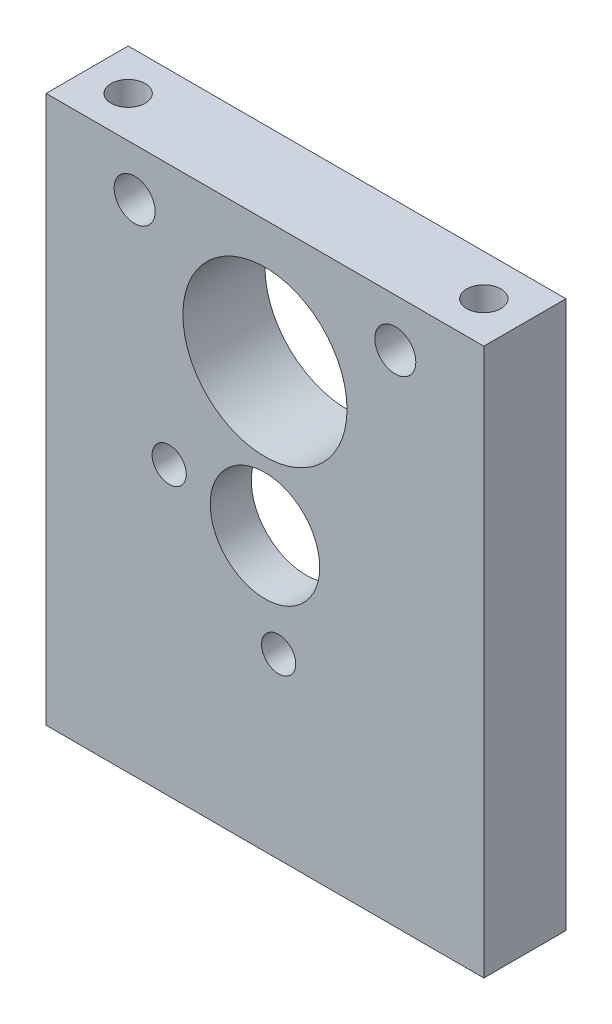
from build123d import *

# Parameters (mm, degrees)
SKETCH1_W           = 32
SKETCH1_H           = 40
EXTRUDE1_DEPTH      = 6
SKETCH8_R           = 6
CUT_EXTRUDE6_DEPTH  = 6
SKETCH5_R           = 1.5
CUT_EXTRUDE4_DEPTH  = 6
CIRPATTERN1_COUNT   = 3
CUT_EXTRUDE13_DEPTH = 3
SKETCH20_R          = 4
CUT_EXTRUDE14_DEPTH = 3
SKETCH25_R          = 1.25
EXTRUDE4_DEPTH      = 3
SKETCH29_R          = 1.25
EXTRUDE7_DEPTH      = 10
EXTRUDE13_START     = -10
SKETCH27_R          = 1.25
EXTRUDE13_DEPTH     = 10


# Read off the part's stored shape, not the designer's step: M3 Tapped Hole2
with BuildPart() as part:
    # Sketch1 → Extrude1 (new body)
    with BuildSketch(Plane.XY):
        Rectangle(SKETCH1_W, SKETCH1_H)
    extrude(amount=-EXTRUDE1_DEPTH)

    # Sketch8 → Cut-Extrude6 (cut)
    with BuildSketch(Plane(origin=(0, 0, -6), x_dir=(-1, 0, 0), z_dir=(0, 0, -1))):
        with Locations((0, 11)):
            Circle(SKETCH8_R)
    extrude(amount=-CUT_EXTRUDE6_DEPTH, mode=Mode.SUBTRACT)

    # Sketch5 → Cut-Extrude4 (cut)
    with BuildSketch(Plane(origin=(0, 0, -6), x_dir=(-1, 0, 0), z_dir=(0, 0, -1))):
        Circle(SKETCH5_R)
    cut_extrude4 = extrude(amount=-CUT_EXTRUDE4_DEPTH, mode=Mode.SUBTRACT)

    # CirPattern1: Cut-Extrude4 ×3 about axis
    cirpattern1_axis = Axis((0, 11, 0), (0, 0, 1))
    for i in range(1, CIRPATTERN1_COUNT):
        add(cut_extrude4.rotate(cirpattern1_axis, i * 360 / CIRPATTERN1_COUNT), mode=Mode.SUBTRACT)

    # Sketch19 → Cut-Extrude13 (cut)
    with BuildSketch(Plane(origin=(0, 0, -6), x_dir=(-1, 0, 0), z_dir=(0, 0, -1))):
        with BuildLine():
            Line((10, 4), (0, 4))
            ThreePointArc((0, 4), (-2.828427125, 2.828427125), (-4, 0))
            Line((-4, 0), (-4, -10))
            Line((-4, -10), (0, -10))
            ThreePointArc((0, -10), (7.071067812, -7.071067812), (10, 0))
            Line((10, 0), (10, 4))
        make_face()
    extrude(amount=-CUT_EXTRUDE13_DEPTH, mode=Mode.SUBTRACT)

    # Sketch20 → Cut-Extrude14 (cut)
    with BuildSketch(Plane(origin=(0, 0, -3), x_dir=(-1, 0, 0), z_dir=(0, 0, -1))):
        with Locations(Location((0, 0, 0), (0, 0, 180))):
            Circle(SKETCH20_R)
    extrude(amount=-CUT_EXTRUDE14_DEPTH, mode=Mode.SUBTRACT)

    # Sketch25 → Extrude4 (cut)
    with BuildSketch(Plane(origin=(0, 0, -3), x_dir=(-1, 0, 0), z_dir=(0, 0, -1))):
        with Locations((-1, -7)):
            Circle(SKETCH25_R)
        with Locations((7, 1)):
            Circle(SKETCH25_R)
    extrude(amount=-EXTRUDE4_DEPTH, mode=Mode.SUBTRACT)

    # Sketch29 → Extrude7 (cut)
    with BuildSketch(Plane.XZ.offset(20)):
        with Locations(Location((-13, -3, 0), (0, 0, 270))):
            Circle(SKETCH29_R)
        with Locations(Location((13, -3, 0), (0, 0, 270))):
            Circle(SKETCH29_R)
    extrude(amount=-EXTRUDE7_DEPTH, mode=Mode.SUBTRACT)

    # Sketch27 → Extrude13 (cut)
    with BuildSketch(Plane(origin=(0, 20, 0), x_dir=(1, 0, 0), z_dir=(0, 1, 0)).offset(EXTRUDE13_START)):
        with Locations(Location((-13, 3, 0), (0, 0, 90))):
            Circle(SKETCH27_R)
        with Locations(Location((13, 3, 0), (0, 0, 90))):
            Circle(SKETCH27_R)
    extrude(amount=EXTRUDE13_DEPTH, mode=Mode.SUBTRACT)

    # M3 Tapped Hole2 outline → M3 Tapped Hole2 (revolve, cut)
    with BuildSketch(Plane(origin=(13, 0, -3), x_dir=(1, 0, 0), z_dir=(0, 0, 1))):
        Polygon((1.25, -10), (0, -9.248924226), (0, -10), align=None)
        Polygon((0, 10), (0, 9.248924226), (1.25, 10), align=None)
    revolve(axis=Axis((13, 0, -3), (0, 1, 0)), mode=Mode.SUBTRACT)

    # M3 Tapped Hole2 2 outline → M3 Tapped Hole2 2 (revolve, cut)
    with BuildSketch(Plane(origin=(-13, 0, -3), x_dir=(1, 0, 0), z_dir=(0, 0, 1))):
        Polygon((1.25, -10), (0, -9.248924226), (0, -10), align=None)
        Polygon((0, 10), (0, 9.248924226), (1.25, 10), align=None)
    revolve(axis=Axis((-13, 0, -3), (0, 1, 0)), mode=Mode.SUBTRACT)


solid = part.part
